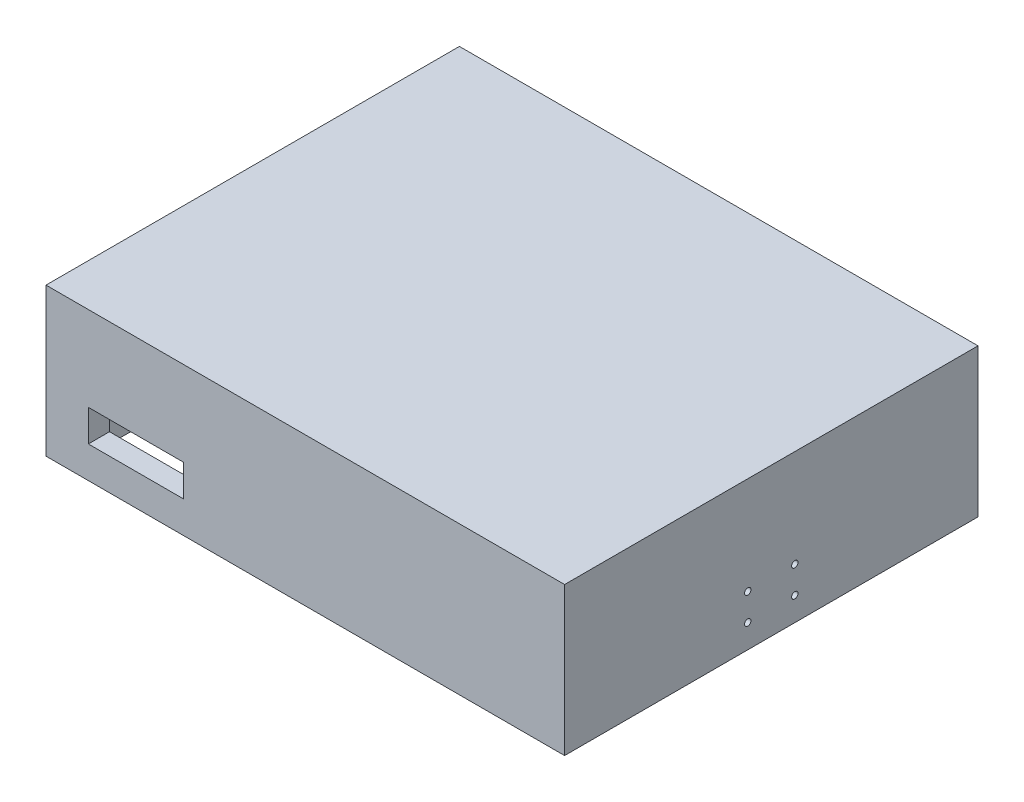
from build123d import *

# Parameters (mm, degrees)
SKETCH1_W           = 245
SKETCH1_H           = 195.3
BOSS_EXTRUDE1_DEPTH = 70
SKETCH2_W           = 225
SKETCH2_H           = 175.3
CUT_EXTRUDE1_DEPTH  = 60
SKETCH3_R           = 1.5
CUT_EXTRUDE2_DEPTH  = 5
SKETCH5_W           = 204
SKETCH5_H           = 2
BOSS_EXTRUDE3_DEPTH = 3
SKETCH6_W           = 60
SKETCH6_H           = 30
CUT_EXTRUDE3_DEPTH  = 10
SKETCH7_W           = 45
SKETCH7_H           = 14
CUT_EXTRUDE5_DEPTH  = 10
SKETCH8_W           = 45
SKETCH8_H           = 15
CUT_EXTRUDE6_DEPTH  = 10


with BuildPart() as part:
    # Sketch1 → Boss-Extrude1 (new body)
    with BuildSketch(Plane(origin=(0, 0, 0), x_dir=(1, 0, 0), z_dir=(0, 1, 0))):
        Rectangle(SKETCH1_W, SKETCH1_H)
    extrude(amount=BOSS_EXTRUDE1_DEPTH)

    # Sketch2 → Cut-Extrude1 (cut)
    with BuildSketch(Plane.XZ):
        Rectangle(SKETCH2_W, SKETCH2_H)
    extrude(amount=-CUT_EXTRUDE1_DEPTH, mode=Mode.SUBTRACT)

    # Sketch3 → Cut-Extrude2 (cut)
    with BuildSketch(Plane(origin=(122.5, 0, 0), x_dir=(0, 0, -1), z_dir=(1, 0, 0))):
        with Locations((-11.115, 23.9)):
            Circle(SKETCH3_R)
        with Locations((11.11, 23.900076156)):
            Circle(SKETCH3_R)
        with Locations((-11.115, 11.2)):
            Circle(SKETCH3_R)
        with Locations((11.11, 11.2)):
            Circle(SKETCH3_R)
    extrude(amount=-CUT_EXTRUDE2_DEPTH, mode=Mode.SUBTRACT)

    # Sketch5 → Boss-Extrude3 (add)
    with BuildSketch(Plane.XZ):
        with Locations((5.5, -92.65)):
            Rectangle(SKETCH5_W, SKETCH5_H)
        with Locations((5.5, 92.65)):
            Rectangle(SKETCH5_W, SKETCH5_H)
    extrude(amount=BOSS_EXTRUDE3_DEPTH)

    # Sketch6 → Cut-Extrude3 (cut)
    with BuildSketch(Plane.ZY.offset(122.5)):
        with Locations((-52.65, 15)):
            Rectangle(SKETCH6_W, SKETCH6_H)
    extrude(amount=-CUT_EXTRUDE3_DEPTH, mode=Mode.SUBTRACT)

    # Sketch7 → Cut-Extrude5 (cut)
    with BuildSketch(Plane(origin=(0, 0, -97.65), x_dir=(-1, 0, 0), z_dir=(0, 0, -1))):
        with Locations((60, 4)):
            Rectangle(SKETCH7_W, SKETCH7_H)
    extrude(amount=-CUT_EXTRUDE5_DEPTH, mode=Mode.SUBTRACT)

    # Sketch8 → Cut-Extrude6 (cut)
    with BuildSketch(Plane.XY.offset(97.65)):
        with Locations((-80, 22.5)):
            Rectangle(SKETCH8_W, SKETCH8_H)
    extrude(amount=-CUT_EXTRUDE6_DEPTH, mode=Mode.SUBTRACT)


solid = part.part
